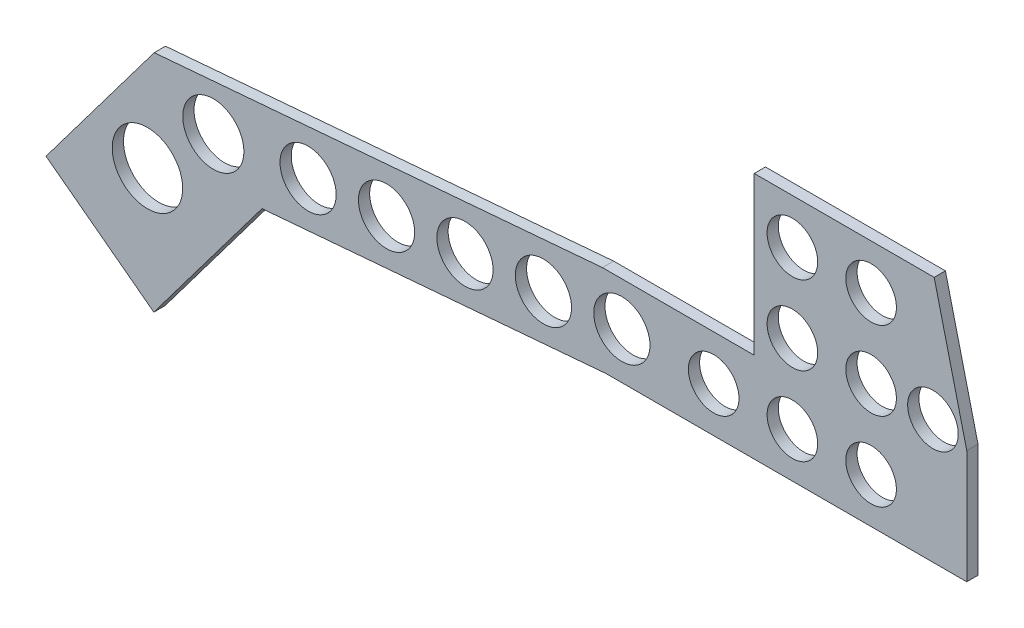
from build123d import *

# Parameters (mm, degrees)
BOSS_EXTRUDE1_DEPTH = 3.175
SKETCH2_R           = 9.946432709
SKETCH2_R_2         = 8.628774031
SKETCH2_R_3         = 7.9375
SKETCH2_R_4         = 7.14375
CUT_EXTRUDE1_DEPTH  = 233.544059515


with BuildPart() as part:
    # Sketch1 → Boss-Extrude1 (new body)
    with BuildSketch(Plane.XY):
        Polygon((0, 0), (50.8, 0), (60, -37.754085603), (60, -69.85), (-41.787887726, -69.85), (-138.966701689, -78.087543548), (-169.514196693, -118.67683461), (-199.95616499, -95.766213357), (-169.408669986, -55.176922294), (-42.8625, -44.45), (0, -44.45), align=None)
    extrude(amount=BOSS_EXTRUDE1_DEPTH)

    # Sketch2 → Cut-Extrude1 (cut, through all)
    with BuildSketch(Plane.XY.offset(3.175)):
        with Locations((-171.31481468, -84.35191449)):
            Circle(SKETCH2_R)
        with Locations((-152.715034722, -66.714192116)):
            Circle(SKETCH2_R_2)
        with Locations((-125.957448531, -64.239244165)):
            Circle(SKETCH2_R_3)
        with Locations((-103.811868784, -62.362032763)):
            Circle(SKETCH2_R_3)
        with Locations((-81.666289037, -60.484821362)):
            Circle(SKETCH2_R_3)
        with Locations((-59.52070929, -58.60760996)):
            Circle(SKETCH2_R_3)
        with Locations((-37.375129542, -56.730398559)):
            Circle(SKETCH2_R_3)
        with Locations((-11.455180712, -57.15)):
            Circle(SKETCH2_R_4)
        with Locations((10.769819288, -57.15)):
            Circle(SKETCH2_R_4)
        with Locations((32.994819288, -57.15)):
            Circle(SKETCH2_R_4)
        with Locations((10.769819288, -34.925)):
            Circle(SKETCH2_R_4)
        with Locations((32.994819288, -34.925)):
            Circle(SKETCH2_R_4)
        with Locations((10.769819288, -12.7)):
            Circle(SKETCH2_R_4)
        with Locations((32.994819288, -12.7)):
            Circle(SKETCH2_R_4)
        with Locations((-11.455180712, -34.925)):
            Circle(SKETCH2_R_4)
        with Locations((-11.455180712, -12.7)):
            Circle(SKETCH2_R_4)
        with Locations((50.457319288, -34.925)):
            Circle(SKETCH2_R_4)
    extrude(amount=-CUT_EXTRUDE1_DEPTH, mode=Mode.SUBTRACT)


solid = part.part
